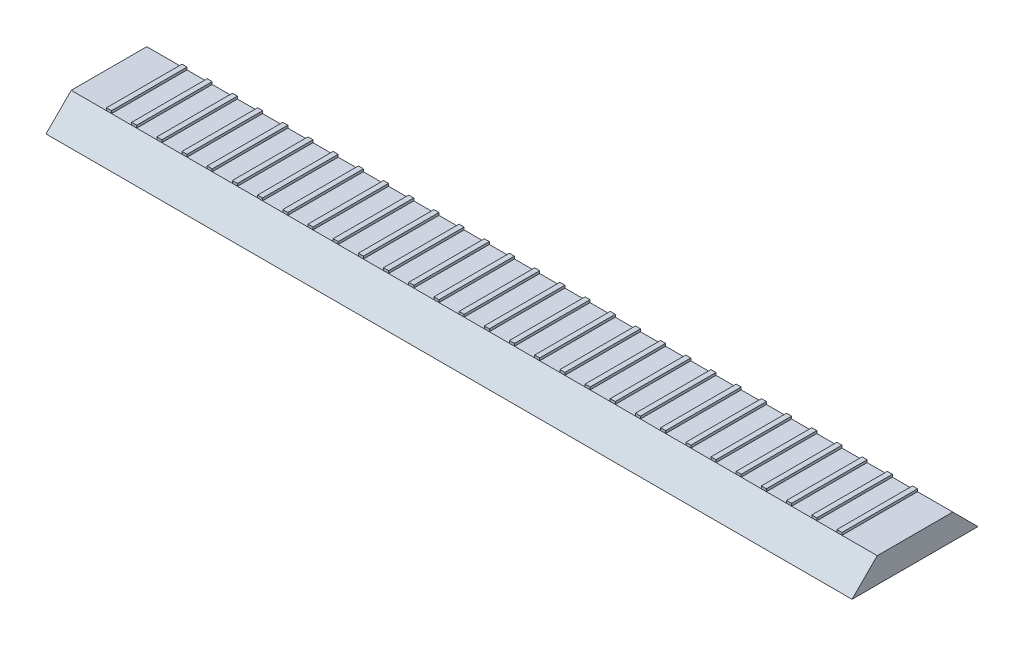
from build123d import *

# Parameters (mm, degrees)
SKETCH1_W           = 160
SKETCH1_H           = 35
BOSS_EXTRUDE1_DEPTH = 5
CHAMFER1_SIZE       = 10
SKETCH2_W           = 1
SKETCH2_H           = 15
BOSS_EXTRUDE2_DEPTH = 0.5


with BuildPart() as part:
    # Sketch1 → Boss-Extrude1 (new body)
    with BuildSketch(Plane(origin=(0, 0, 0), x_dir=(1, 0, 0), z_dir=(0, 1, 0))):
        Rectangle(SKETCH1_W, SKETCH1_H)
    extrude(amount=BOSS_EXTRUDE1_DEPTH)

    # Chamfer1
    # the kernel refuses this chamfer: 10 mm, written as the material it takes off along each edge
    with BuildSketch(Plane(origin=(105.71682988, 5, -17.5), x_dir=(0, -0.9996219169112968, -0.027495876610586317), z_dir=(-1, 0, 0)), Plane(origin=(-105.71682988, 5, 17.5), x_dir=(0, -0.9996219169112968, 0.027495876610586317), z_dir=(1, 0, 0))) as chamfer1_piece_1:
        Polygon((CHAMFER1_SIZE * 0.999621916911, CHAMFER1_SIZE * 0.0274958766106), (-CHAMFER1_SIZE * 0.0274958766106, CHAMFER1_SIZE * 0.999621916911), (0, 0), align=None)
    extrude(amount=211.433659759, mode=Mode.SUBTRACT)

    # Sketch2 → Boss-Extrude2 (add)
    with BuildSketch(Plane(origin=(0, 5, 0), x_dir=(1, 0, 0), z_dir=(0, 1, 0))):
        with Locations((72.5, 0)):
            Rectangle(SKETCH2_W, SKETCH2_H)
        with Locations((67.5, 0)):
            Rectangle(SKETCH2_W, SKETCH2_H)
        with Locations((62.5, 0)):
            Rectangle(SKETCH2_W, SKETCH2_H)
        with Locations((57.5, 0)):
            Rectangle(SKETCH2_W, SKETCH2_H)
        with Locations((52.5, 0)):
            Rectangle(SKETCH2_W, SKETCH2_H)
        with Locations((47.5, 0)):
            Rectangle(SKETCH2_W, SKETCH2_H)
        with Locations((42.5, 0)):
            Rectangle(SKETCH2_W, SKETCH2_H)
        with Locations((37.5, 0)):
            Rectangle(SKETCH2_W, SKETCH2_H)
        with Locations((32.5, 0)):
            Rectangle(SKETCH2_W, SKETCH2_H)
        with Locations((27.5, 0)):
            Rectangle(SKETCH2_W, SKETCH2_H)
        with Locations((22.5, 0)):
            Rectangle(SKETCH2_W, SKETCH2_H)
        with Locations((17.5, 0)):
            Rectangle(SKETCH2_W, SKETCH2_H)
        with Locations((12.5, 0)):
            Rectangle(SKETCH2_W, SKETCH2_H)
        with Locations((7.5, 0)):
            Rectangle(SKETCH2_W, SKETCH2_H)
        with Locations((2.5, 0)):
            Rectangle(SKETCH2_W, SKETCH2_H)
        with Locations((-2.5, 0)):
            Rectangle(SKETCH2_W, SKETCH2_H)
        with Locations((-7.5, 0)):
            Rectangle(SKETCH2_W, SKETCH2_H)
        with Locations((-12.5, 0)):
            Rectangle(SKETCH2_W, SKETCH2_H)
        with Locations((-17.5, 0)):
            Rectangle(SKETCH2_W, SKETCH2_H)
        with Locations((-22.5, 0)):
            Rectangle(SKETCH2_W, SKETCH2_H)
        with Locations((-27.5, 0)):
            Rectangle(SKETCH2_W, SKETCH2_H)
        with Locations((-32.5, 0)):
            Rectangle(SKETCH2_W, SKETCH2_H)
        with Locations((-37.5, 0)):
            Rectangle(SKETCH2_W, SKETCH2_H)
        with Locations((-42.5, 0)):
            Rectangle(SKETCH2_W, SKETCH2_H)
        with Locations((-47.5, 0)):
            Rectangle(SKETCH2_W, SKETCH2_H)
        with Locations((-52.5, 0)):
            Rectangle(SKETCH2_W, SKETCH2_H)
        with Locations((-57.5, 0)):
            Rectangle(SKETCH2_W, SKETCH2_H)
        with Locations((-62.5, 0)):
            Rectangle(SKETCH2_W, SKETCH2_H)
        with Locations((-67.5, 0)):
            Rectangle(SKETCH2_W, SKETCH2_H)
        with Locations((-72.5, 0)):
            Rectangle(SKETCH2_W, SKETCH2_H)
    extrude(amount=BOSS_EXTRUDE2_DEPTH)


solid = part.part
